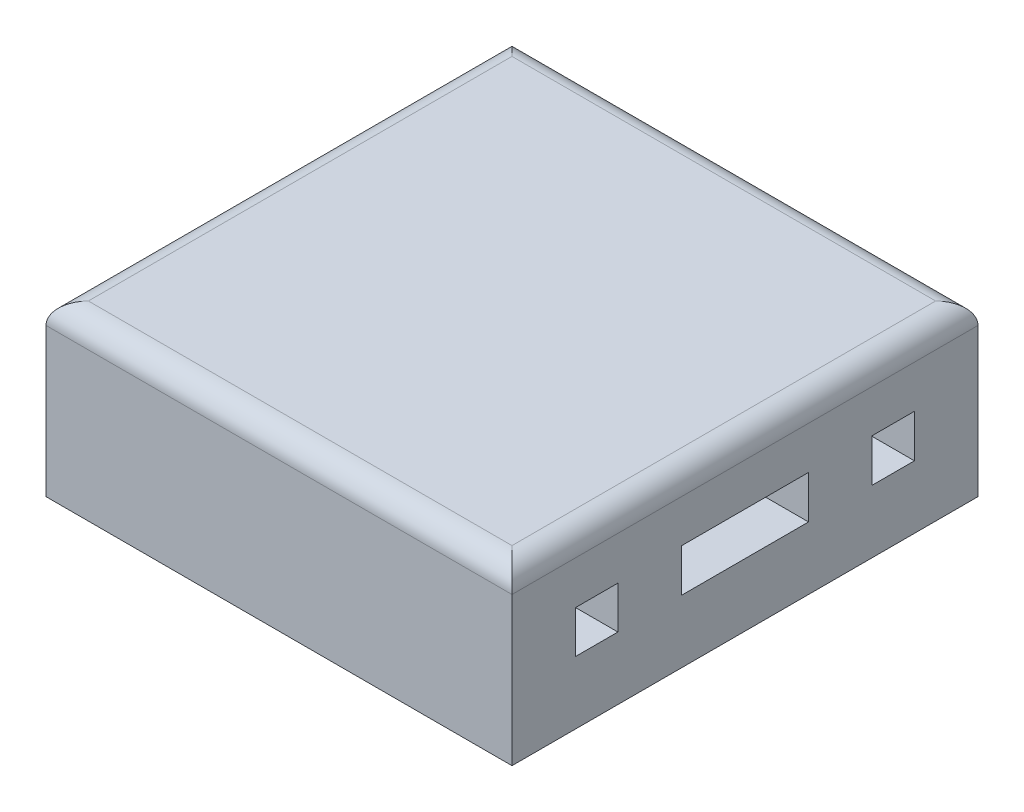
from build123d import *

# Parameters (mm, degrees)
SKETCH2_W               = 11
SKETCH2_H               = 11
BOSS_EXTRUDE1_DEPTH     = 4
CUT_EXTRUDE2_DEPTH      = 9.746427842
CUT_EXTRUDE2_DEPTH_BACK = 9.746427842
SKETCH4_W               = 1
SKETCH4_H               = 1
SKETCH4_W_2             = 3
SKETCH4_H_2             = 1.012866832
CUT_EXTRUDE3_DEPTH      = 2.5
CUT_EXTRUDE3_DEPTH_BACK = 9.746427842
SKETCH5_R               = 2.25
SKETCH8_R               = 0.289167391
CUT_EXTRUDE4_DEPTH      = 0.55
SKETCH8_3_R             = 0.26
CUT_EXTRUDE5_DEPTH      = 0.55
FILLET2_R               = 0.5


with BuildPart() as part:
    # Sketch2 → Boss-Extrude1 (new body)
    with BuildSketch(Plane(origin=(0, 0, 0), x_dir=(1, 0, 0), z_dir=(0, 1, 0))):
        Rectangle(SKETCH2_W, SKETCH2_H)
    extrude(amount=BOSS_EXTRUDE1_DEPTH)

    # Sketch4 → Cut-Extrude2 (cut, two sides: drawn at the far end of the back side and taken through both)
    with BuildSketch(Plane(origin=(0, 0, 0), x_dir=(0, 0, -1), z_dir=(1, 0, 0)).offset(-CUT_EXTRUDE2_DEPTH_BACK)):
        with Locations((-3.5, 1.982791405)):
            Rectangle(SKETCH4_W, SKETCH4_H)
        with Locations((0, 1.989224821)):
            Rectangle(SKETCH4_W_2, SKETCH4_H_2)
        with Locations((3.5, 1.989224821)):
            Rectangle(SKETCH4_W, SKETCH4_H_2)
    extrude(amount=CUT_EXTRUDE2_DEPTH + CUT_EXTRUDE2_DEPTH_BACK, mode=Mode.SUBTRACT)

    # Sketch5 → Cut-Extrude3 (cut, two sides: drawn at the far end of the back side and taken through both)
    with BuildSketch(Plane(origin=(0, 0, 0), x_dir=(1, 0, 0), z_dir=(0, 1, 0)).offset(-CUT_EXTRUDE3_DEPTH_BACK)):
        Circle(SKETCH5_R)
    extrude(amount=CUT_EXTRUDE3_DEPTH + CUT_EXTRUDE3_DEPTH_BACK, mode=Mode.SUBTRACT)

    # Sketch8 → Cut-Extrude4 (cut)
    with BuildSketch(Plane(origin=(0, 0, 0), x_dir=(1, 0, 0), z_dir=(0, 1, 0))):
        with Locations((0, -4.125)):
            Circle(SKETCH8_R)
    extrude(amount=CUT_EXTRUDE4_DEPTH, mode=Mode.SUBTRACT)

    # Sketch8<3> → Cut-Extrude5 (cut)
    with BuildSketch(Plane(origin=(0, 0, 0), x_dir=(1, 0, 0), z_dir=(0, 1, 0))):
        with Locations((0, 4.125)):
            Circle(SKETCH8_3_R)
    extrude(amount=CUT_EXTRUDE5_DEPTH, mode=Mode.SUBTRACT)

    # Fillet2
    fillet2_edges = [part.edges().sort_by_distance(p)[0] for p in [
        (0, 4, 5.5),
        (-5.5, 4, 0),
        (0, 4, -5.5),
        (5.5, 4, 0),
    ]]
    fillet(fillet2_edges, radius=FILLET2_R)


solid = part.part
